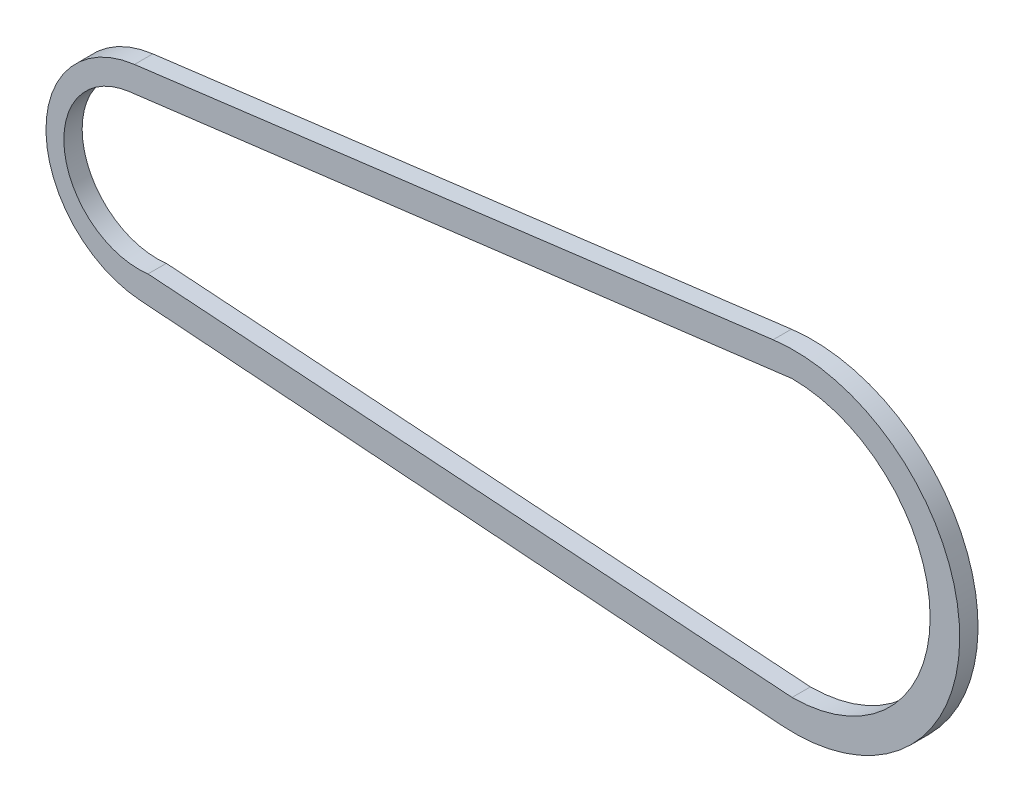
from build123d import *

# Parameters (mm, degrees)
EXTRUDE_1_DEPTH     = 10
FILLET_1_R          = 55.243368
FILLET_2_R          = 90.446111
CUT_EXTRUDE_1_DEPTH = 10


with BuildPart() as part:
    # 草图1 → 凸台-拉伸1 (new body)
    with BuildSketch(Plane.XY):
        Polygon((424.616260913, 129.386586507), (424.616260913, -70.613413493), (-74.025647104, -33.786146841), (-74.025647104, 66.213853159), align=None)
    extrude(amount=EXTRUDE_1_DEPTH)

    # 圆角1
    fillet_1_edges = [part.edges().sort_by_distance(p)[0] for p in [
        (-74.025647104, -33.786146841, 5),
        (-74.025647104, 66.213853159, 5),
    ]]
    fillet(fillet_1_edges, radius=FILLET_1_R - 0.0001)  # a hair under: the kernel refuses the full size

    # 圆角2
    fillet_2_edges = [part.edges().sort_by_distance(p)[0] for p in [
        (424.616260913, 129.386586507, 5),
        (424.616260913, -70.613413493, 5),
    ]]
    fillet(fillet_2_edges, radius=FILLET_2_R - 0.0001)  # a hair under: the kernel refuses the full size

    # 草图2 → 切除-拉伸1 (cut)
    with BuildSketch(Plane.XY.offset(10)):
        with BuildLine():
            Line((-28.487167505, 58.083637567), (333.136967432, 103.286654435))
            ThreePointArc((333.136967432, 103.286654435), (408.475328877, 27.948292989), (333.136967432, -47.390068456))
            Line((333.136967432, -47.390068456), (-18.353743943, -22.983750924))
            ThreePointArc((-18.353743943, -22.983750924), (-63.95414997, 12.483231541), (-28.487167505, 58.083637567))
        make_face()
    extrude(amount=-CUT_EXTRUDE_1_DEPTH, mode=Mode.SUBTRACT)


solid = part.part
